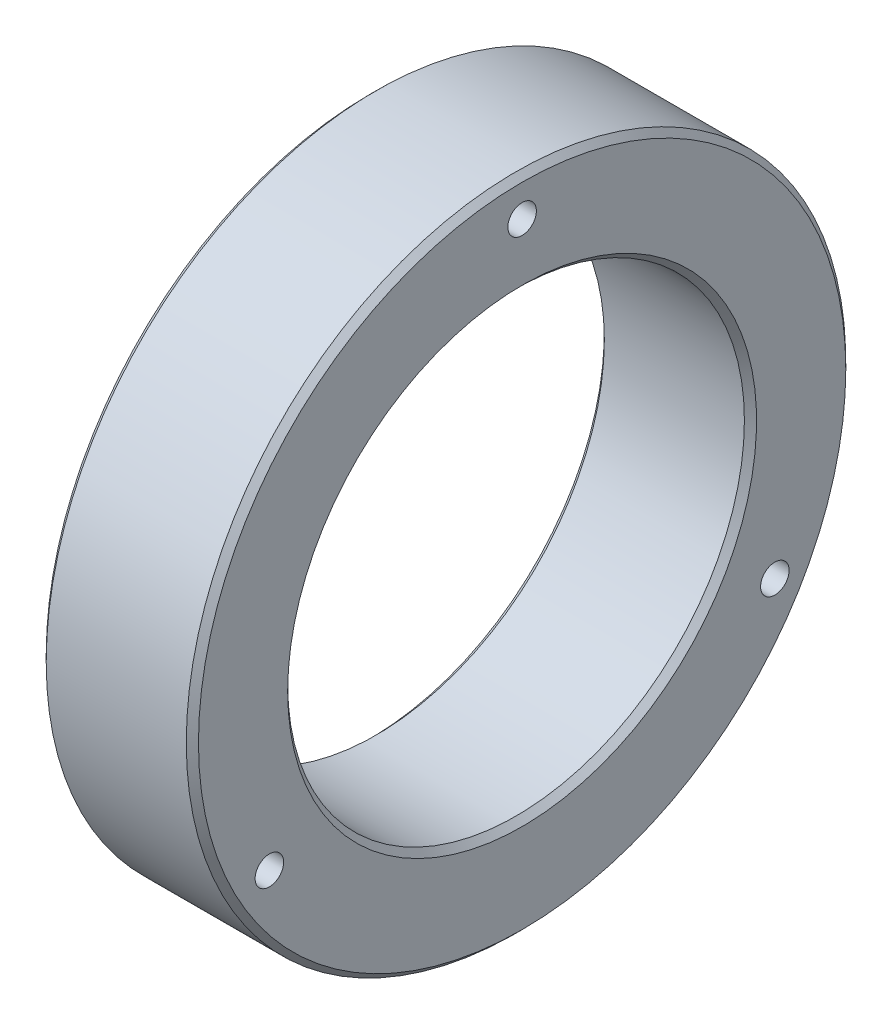
from build123d import *

# Parameters (mm, degrees)
SKETCH1_W          = 38.1
SKETCH1_H          = 25.3746
CHAMFER1_SIZE      = 1.524
CUT_EXTRUDE2_START = -19.05
SKETCH2_R          = 3.5687
CUT_EXTRUDE2_DEPTH = 76.2
CUT_EXTRUDE4_START = -19.05
SKETCH3_R          = 5.5626
CUT_EXTRUDE4_DEPTH = 9.652
CUT_EXTRUDE6_START = -19.05
SKETCH4_R          = 3.96875
CUT_EXTRUDE6_DEPTH = 25.4


with BuildPart() as part:
    # Sketch1 → Revolve1 (revolve)
    with BuildSketch(Plane(origin=(0, 0, 0), x_dir=(1, 0, 0), z_dir=(0, 1, 0))):
        with Locations((0, 69.8373)):
            Rectangle(SKETCH1_W, SKETCH1_H)
    revolve(axis=Axis((-44.45, 0, 0), (1, 0, 0)))

    # Chamfer1
    chamfer1_edges = [part.edges().sort_by_distance(p)[0] for p in [
        (19.05, 0, 57.15),
        (-19.05, 0, 57.15),
        (19.05, 0, 82.5246),
        (-19.05, 0, 82.5246),
    ]]
    chamfer(chamfer1_edges, length=CHAMFER1_SIZE)

    # Sketch2 → Cut-Extrude2 (cut)
    with BuildSketch(Plane(origin=(0, 0, 0), x_dir=(0, 0, -1), z_dir=(1, 0, 0)).offset(CUT_EXTRUDE2_START)):
        with Locations((0, 73.025)):
            Circle(SKETCH2_R)
        with Locations((-63.246, -36.5252)):
            Circle(SKETCH2_R)
        with Locations((63.246, -36.5252)):
            Circle(SKETCH2_R)
    extrude(amount=CUT_EXTRUDE2_DEPTH, mode=Mode.SUBTRACT)

    # Sketch3 → Cut-Extrude4 (cut)
    with BuildSketch(Plane(origin=(0, 0, 0), x_dir=(0, 0, -1), z_dir=(1, 0, 0)).offset(CUT_EXTRUDE4_START)):
        with Locations((0, 73.025)):
            Circle(SKETCH3_R)
        with Locations((-63.246, -36.5252)):
            Circle(SKETCH3_R)
        with Locations((63.246, -36.5252)):
            Circle(SKETCH3_R)
    extrude(amount=CUT_EXTRUDE4_DEPTH, mode=Mode.SUBTRACT)

    # Sketch4 → Cut-Extrude6 (cut)
    with BuildSketch(Plane(origin=(0, 0, 0), x_dir=(0, 0, -1), z_dir=(1, 0, 0)).offset(CUT_EXTRUDE6_START)):
        with Locations((-69.85, 0)):
            Circle(SKETCH4_R)
        with Locations((69.85, 0)):
            Circle(SKETCH4_R)
    extrude(amount=CUT_EXTRUDE6_DEPTH, mode=Mode.SUBTRACT)


solid = part.part
